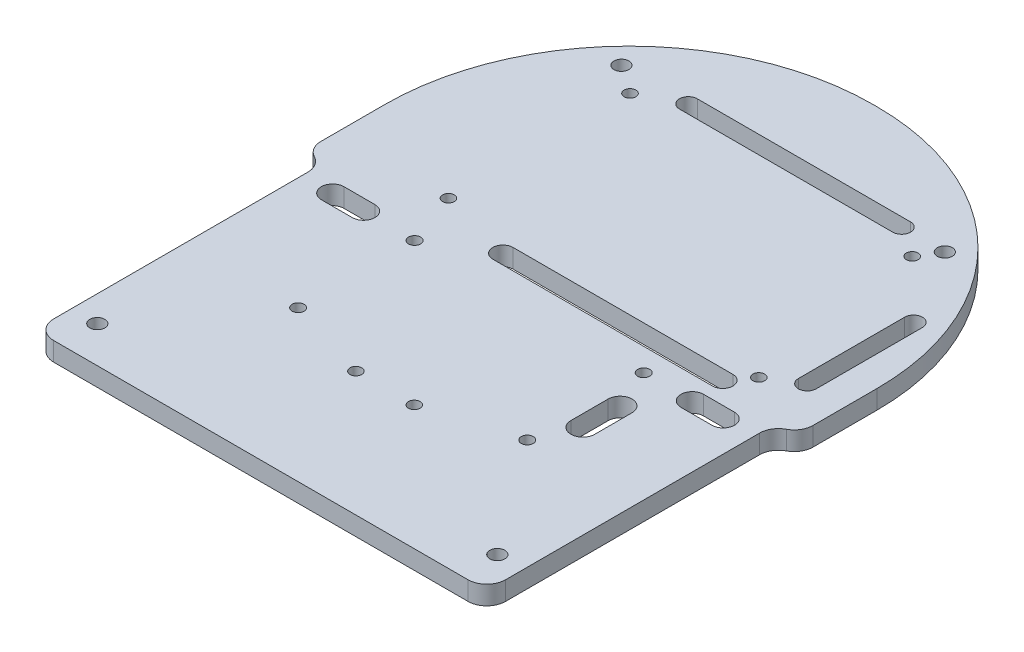
from build123d import *

# Parameters (mm, degrees)
BOSS_EXTRUDE2_DEPTH = 5
FILLET8_R           = 65
SKETCH4_R           = 2
SKETCH4_R_2         = 1.5621
SKETCH4_R_3         = 1.6
SKETCH4_R_4         = 1.55575
CUT_EXTRUDE1_DEPTH  = 5
FILLET9_R           = 5
FILLET10_R          = 5


with BuildPart() as part:
    # Sketch1 → Boss-Extrude2 (new body)
    with BuildSketch(Plane(origin=(0, 0, 0), x_dir=(1, 0, 0), z_dir=(0, 1, 0))):
        Polygon((65.5, 80), (-65.5, 80), (-65.5, -7), (-60.15, -7), (-60.15, -83.5), (60.15, -83.5), (60.15, -7), (65.5, -7), align=None)
    extrude(amount=BOSS_EXTRUDE2_DEPTH)

    # Fillet8
    fillet8_edges = [part.edges().sort_by_distance(p)[0] for p in [
        (65.5, 2.5, -80),
        (-65.5, 2.5, -80),
    ]]
    fillet(fillet8_edges, radius=FILLET8_R)

    # Sketch4 → Cut-Extrude1 (cut)
    with BuildSketch(Plane(origin=(0, 5, 0), x_dir=(1, 0, 0), z_dir=(0, 1, 0))):
        with Locations((43.047144734, 55.54428083)):
            Circle(SKETCH4_R)
        with Locations((-43.047144734, 55.54428083)):
            Circle(SKETCH4_R)
        with Locations((-53.249046458, -73.796312774)):
            Circle(SKETCH4_R)
        with Locations((53.249046458, -73.796312774)):
            Circle(SKETCH4_R)
        with Locations((-35.41902795, 50.193626152)):
            Circle(SKETCH4_R_2)
        with Locations((39.71417205, 50.193626152)):
            Circle(SKETCH4_R_2)
        with Locations((-35.41902795, 1.857426152)):
            Circle(SKETCH4_R_2)
        with Locations((47.20717205, 1.857426152)):
            Circle(SKETCH4_R_2)
        with Locations((-30.18356597, -12.397284441)):
            Circle(SKETCH4_R_3)
        with Locations((30.81643403, -12.397284441)):
            Circle(SKETCH4_R_3)
        with Locations((30.81643403, -43.397284441)):
            Circle(SKETCH4_R_3)
        with Locations((-30.18356597, -43.397284441)):
            Circle(SKETCH4_R_3)
        with Locations((-7.869013511, -50.333617588)):
            Circle(SKETCH4_R_4)
        with Locations((7.688486489, -50.333617588)):
            Circle(SKETCH4_R_4)
        with BuildLine():
            Line((38.485696274, -23.17567799), (38.485696274, -33.090149901))
            ThreePointArc((38.485696274, -33.090149901), (35.309214983, -36.266631193), (32.132733691, -33.090149901))
            Line((32.132733691, -33.090149901), (32.132733691, -23.17567799))
            ThreePointArc((32.132733691, -23.17567799), (35.309214983, -19.999196698), (38.485696274, -23.17567799))
        make_face()
        with BuildLine():
            Line((-25.229195822, 57.914440008), (31.548032439, 57.914440008))
            ThreePointArc((31.548032439, 57.914440008), (33.918191616, 55.54428083), (31.548032439, 53.174121653))
            Line((31.548032439, 53.174121653), (-25.229195822, 53.174121653))
            ThreePointArc((-25.229195822, 53.174121653), (-27.599355, 55.54428083), (-25.229195822, 57.914440008))
        make_face()
        with BuildLine():
            Line((-15.471860298, -0.8868659), (43.047144734, -0.8868659))
            ThreePointArc((43.047144734, -0.8868659), (45.750426625, -3.590147791), (43.047144734, -6.293429682))
            Line((43.047144734, -6.293429682), (-15.471860298, -6.293429682))
            ThreePointArc((-15.471860298, -6.293429682), (-18.175142189, -3.590147791), (-15.471860298, -0.8868659))
        make_face()
        with BuildLine():
            Line((57.484245228, 35.149431205), (57.484245228, 6.868248507))
            ThreePointArc((57.484245228, 6.868248507), (55.106623673, 4.490626953), (52.729002119, 6.868248507))
            Line((52.729002119, 6.868248507), (52.729002119, 35.149431205))
            ThreePointArc((52.729002119, 35.149431205), (55.106623673, 37.52705276), (57.484245228, 35.149431205))
        make_face()
        with BuildLine():
            Line((-51.995557855, -9.38715687), (-43.754184302, -9.38715687))
            ThreePointArc((-43.754184302, -9.38715687), (-40.74405673, -12.397284441), (-43.754184302, -15.407412013))
            Line((-43.754184302, -15.407412013), (-51.995557855, -15.407412013))
            ThreePointArc((-51.995557855, -15.407412013), (-55.005685427, -12.397284441), (-51.995557855, -9.38715687))
        make_face()
        with BuildLine():
            Line((51.995557855, -9.38715687), (43.754184302, -9.38715687))
            ThreePointArc((43.754184302, -9.38715687), (40.74405673, -12.397284441), (43.754184302, -15.407412013))
            Line((43.754184302, -15.407412013), (51.995557855, -15.407412013))
            ThreePointArc((51.995557855, -15.407412013), (55.005685427, -12.397284441), (51.995557855, -9.38715687))
        make_face()
    extrude(amount=-CUT_EXTRUDE1_DEPTH, mode=Mode.SUBTRACT)

    # Fillet9
    fillet9_edges = [part.edges().sort_by_distance(p)[0] for p in [
        (65.5, 2.5, 7),
        (60.15, 2.5, 83.5),
        (-60.15, 2.5, 83.5),
        (-65.5, 2.5, 7),
    ]]
    fillet(fillet9_edges, radius=FILLET9_R)

    # Fillet10
    fillet10_edges = [part.edges().sort_by_distance(p)[0] for p in [
        (60.15, 2.5, 7),
        (-60.15, 2.5, 7),
    ]]
    fillet(fillet10_edges, radius=FILLET10_R)


solid = part.part
